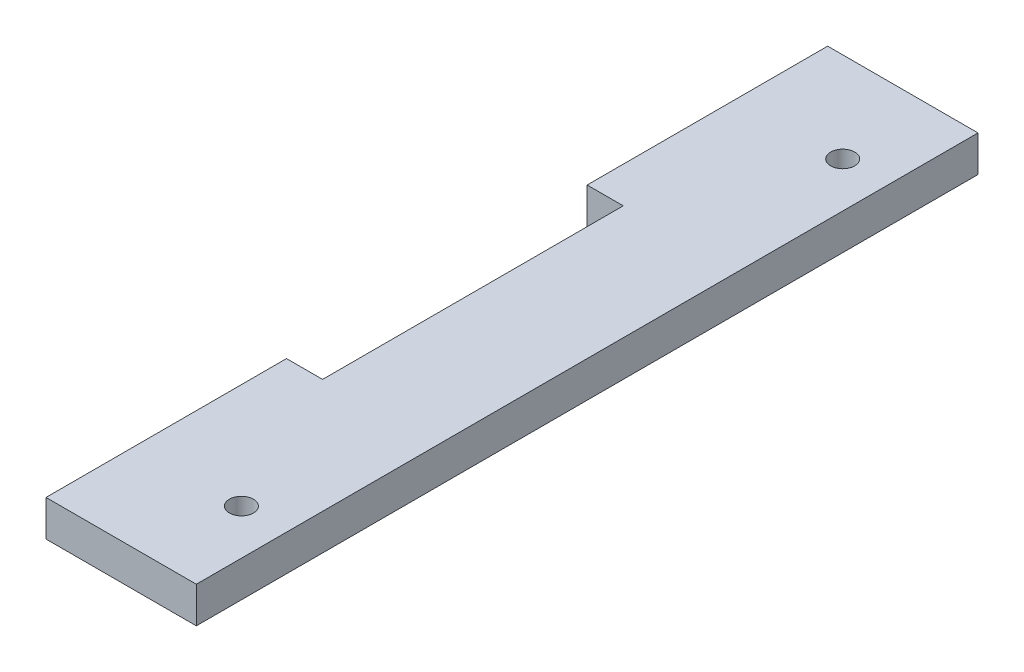
from build123d import *

# Parameters (mm, degrees)
BOSS_EXTRUDE1_DEPTH = 6
SKETCH2_R           = 2
CUT_EXTRUDE1_DEPTH  = 70.936701267


with BuildPart() as part:
    # Sketch1 → Boss-Extrude1 (new body)
    with BuildSketch(Plane(origin=(0, 0, 0), x_dir=(1, 0, 0), z_dir=(0, 1, 0))):
        Polygon((-13.316216216, 61.605405405), (-13.316216216, 21.605405405), (-7.316216216, 21.605405405), (-7.316216216, -28.394594595), (-13.316216216, -28.394594595), (-13.316216216, -68.394594595), (11.683783784, -68.394594595), (11.683783784, 61.605405405), align=None)
    extrude(amount=BOSS_EXTRUDE1_DEPTH)

    # Sketch2 → Cut-Extrude1 (cut, through all)
    with BuildSketch(Plane(origin=(0, 6, 0), x_dir=(1, 0, 0), z_dir=(0, 1, 0))):
        with Locations((4.183783784, -53.394594595)):
            Circle(SKETCH2_R)
        with Locations((4.183783784, 46.605405405)):
            Circle(SKETCH2_R)
    extrude(amount=-CUT_EXTRUDE1_DEPTH, mode=Mode.SUBTRACT)


solid = part.part
